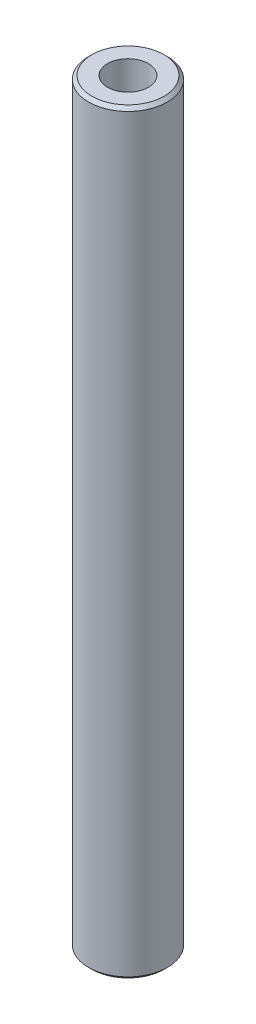
from build123d import *

# Parameters (mm, degrees)
SKETCH1_R           = 5
BOSS_EXTRUDE1_DEPTH = 95.929313469
SKETCH2_R           = 2.599446057
CUT_EXTRUDE1_DEPTH  = 97.189568991
CHAMFER1_SIZE       = 0.425582698


with BuildPart() as part:
    # Sketch1 → Boss-Extrude1 (new body)
    with BuildSketch(Plane(origin=(0, 0, 0), x_dir=(1, 0, 0), z_dir=(0, 1, 0))):
        Circle(SKETCH1_R)
    extrude(amount=BOSS_EXTRUDE1_DEPTH)

    # Sketch2 → Cut-Extrude1 (cut, through all)
    with BuildSketch(Plane(origin=(0, 0, 0), x_dir=(1, 0, 0), z_dir=(0, 1, 0))):
        Circle(SKETCH2_R)
    extrude(amount=CUT_EXTRUDE1_DEPTH, mode=Mode.SUBTRACT)

    # Chamfer1
    chamfer1_edges = [part.edges().sort_by_distance(p)[0] for p in [
        (-5, 95.929313469, 0),
        (-5, 0, 0),
    ]]
    chamfer(chamfer1_edges, length=CHAMFER1_SIZE)


solid = part.part
